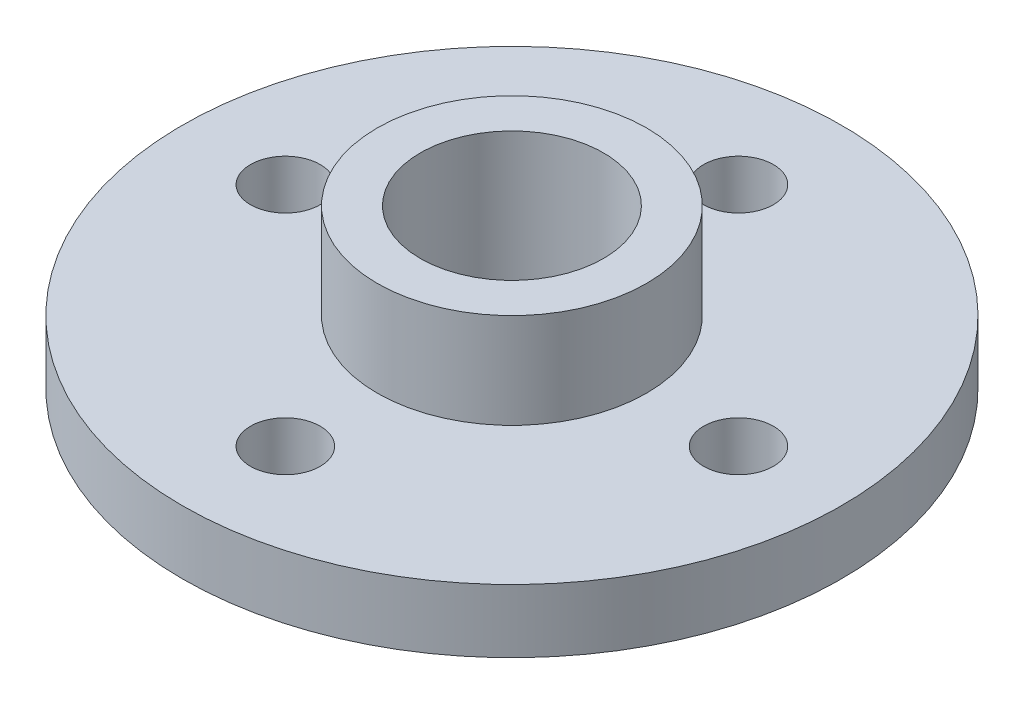
from build123d import *

# Parameters (mm, degrees)
SKETCH2_R                      = 10.4
BOSS_EXTRUDE1_DEPTH            = 2
SKETCH4_R                      = 4.25
BOSS_EXTRUDE2_DEPTH            = 3
SKETCH5_R                      = 1.5
CUT_EXTRUDE2_DEPTH             = 16.534477783
SKETCH6_R                      = 2.89
CUT_EXTRUDE3_DEPTH             = 4.5
M2_CLEARANCE_HOLE1_D           = 2.2
M2_CLEARANCE_HOLE1_CSINK_D     = 2.25
M2_CLEARANCE_HOLE1_CSINK_ANGLE = 90


with BuildPart() as part:
    # Sketch2 → Boss-Extrude1 (new body)
    with BuildSketch(Plane(origin=(0, 0, 0), x_dir=(1, 0, 0), z_dir=(0, 1, 0))):
        Circle(SKETCH2_R)
    extrude(amount=BOSS_EXTRUDE1_DEPTH)

    # Sketch4 → Boss-Extrude2 (add)
    with BuildSketch(Plane(origin=(0, 2, 0), x_dir=(1, 0, 0), z_dir=(0, 1, 0))):
        Circle(SKETCH4_R)
    extrude(amount=BOSS_EXTRUDE2_DEPTH)

    # Sketch5 → Cut-Extrude2 (cut, through all)
    with BuildSketch(Plane(origin=(0, 5, 0), x_dir=(1, 0, 0), z_dir=(0, 1, 0))):
        Circle(SKETCH5_R)
    extrude(amount=-CUT_EXTRUDE2_DEPTH, mode=Mode.SUBTRACT)

    # Sketch6 → Cut-Extrude3 (cut)
    with BuildSketch(Plane(origin=(0, 5, 0), x_dir=(1, 0, 0), z_dir=(0, 1, 0))):
        Circle(SKETCH6_R)
    extrude(amount=-CUT_EXTRUDE3_DEPTH, mode=Mode.SUBTRACT)

    # M2 Clearance Hole1 (through all)
    with Locations(Plane(origin=(0, 0, 0), x_dir=(-1, 0, 0), z_dir=(0, -1, 0))):
        with Locations((0, 7.15), (-7.15, 0), (0, -7.15), (7.15, 0)):
            CounterSinkHole(M2_CLEARANCE_HOLE1_D / 2, M2_CLEARANCE_HOLE1_CSINK_D / 2, counter_sink_angle=M2_CLEARANCE_HOLE1_CSINK_ANGLE)


solid = part.part
